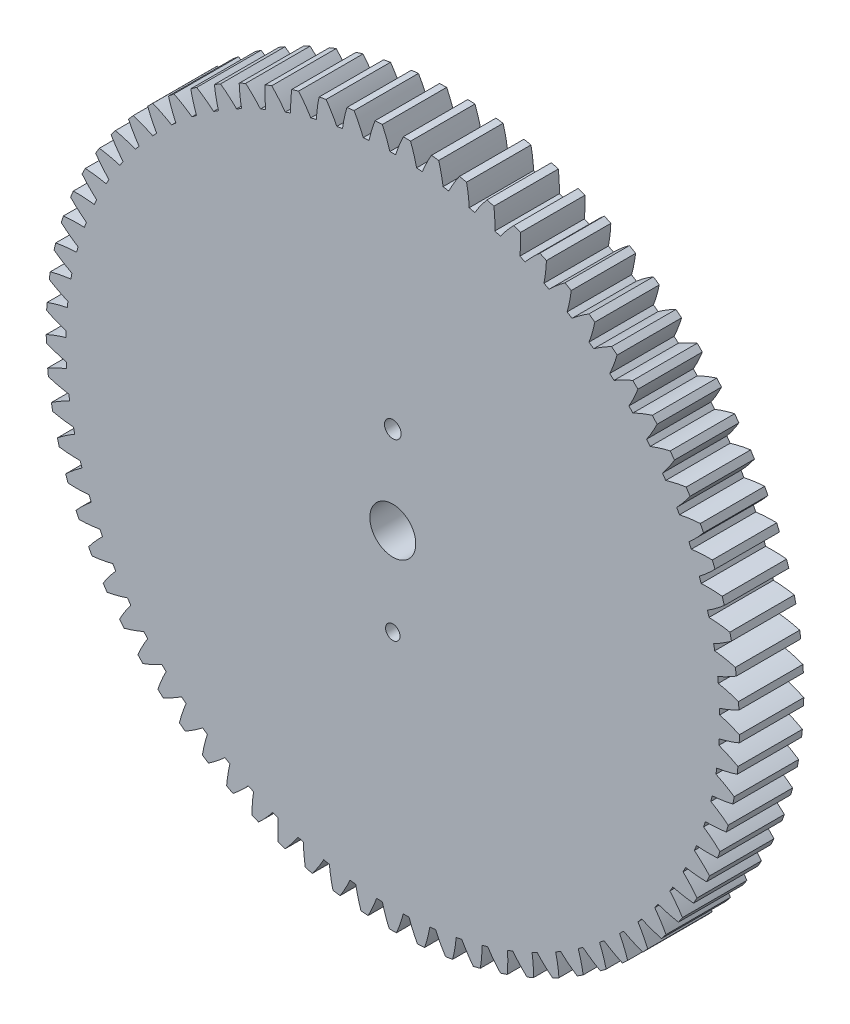
from build123d import *

# Parameters (mm, degrees)
MODEL_R             = 0.825
MODEL_R_2           = 2.625
MODEL_R_3           = 0.95
BOSS_EXTRUDE1_DEPTH = 7.364143065


with BuildPart() as part:
    # Model → Boss-Extrude1 (new body)
    with BuildSketch(Plane.XY):
        with BuildLine():
            ThreePointArc((-39.523511849, 2.834190565), (-39.550816975, 2.42353081), (-39.573855354, 2.012609605))
            ThreePointArc((-39.573855354, 2.012609605), (-38.483782884, 1.509137576), (-37.358060536, 1.091416054))
            ThreePointArc((-37.358060536, 1.091416054), (-37.366223524, 0.762374936), (-37.371488451, 0.433274691))
            ThreePointArc((-37.371488451, 0.433274691), (-38.513312242, 0.06181742), (-39.623013466, -0.396773105))
            ThreePointArc((-39.623013466, -0.396773105), (-39.616755155, -0.808292044), (-39.606222982, -1.219723785))
            ThreePointArc((-39.606222982, -1.219723785), (-38.478739993, -1.632669526), (-37.322715212, -1.957244292))
            ThreePointArc((-37.322715212, -1.957244292), (-37.304031133, -2.285855912), (-37.282453816, -2.614290244))
            ThreePointArc((-37.282453816, -2.614290244), (-38.390201066, -3.077580761), (-39.458830466, -3.625096314))
            ThreePointArc((-39.458830466, -3.625096314), (-39.419050364, -4.034735848), (-39.37501773, -4.443940114))
            ThreePointArc((-39.37501773, -4.443940114), (-38.217627437, -4.763611481), (-37.038993376, -4.9928795))
            ThreePointArc((-37.038993376, -4.9928795), (-36.993586569, -5.318874766), (-36.945310601, -5.644457508))
            ThreePointArc((-36.945310601, -5.644457508), (-38.011609436, -6.196498149), (-39.032055459, -6.829295106))
            ThreePointArc((-39.032055459, -6.829295106), (-38.959018298, -7.234329151), (-38.881778232, -7.638582755))
            ThreePointArc((-38.881778232, -7.638582755), (-37.702182875, -7.862852388), (-36.50878315, -7.995287919))
            ThreePointArc((-36.50878315, -7.995287919), (-36.43695579, -8.316497386), (-36.362302441, -8.637061839))
            ThreePointArc((-36.362302441, -8.637061839), (-37.380056817, -9.274178864), (-38.345528563, -9.988046066))
            ThreePointArc((-38.345528563, -9.988046066), (-38.239720392, -10.385779186), (-38.129786915, -10.782391887))
            ThreePointArc((-38.129786915, -10.782391887), (-36.935836507, -10.90976731), (-35.735612996, -10.944489016))
            ThreePointArc((-35.735612996, -10.944489016), (-35.637843082, -11.258775088), (-35.537309157, -11.572187948))
            ThreePointArc((-35.537309157, -11.572187948), (-36.499746087, -12.290141449), (-37.403818501, -13.080328227))
            ThreePointArc((-37.403818501, -13.080328227), (-37.265943457, -13.468113575), (-37.124048157, -13.854445981))
            ThreePointArc((-37.124048157, -13.854445981), (-35.923688241, -13.88407953), (-34.724628233, -13.820856344))
            ThreePointArc((-34.724628233, -13.820856344), (-34.601566408, -14.126127499), (-34.475820943, -14.430303056))
            ThreePointArc((-34.475820943, -14.430303056), (-35.376535569, -15.22431517), (-36.213192198, -16.085562962))
            ThreePointArc((-36.213192198, -16.085562962), (-36.044167816, -16.46081989), (-35.871254983, -16.834301023))
            ThreePointArc((-35.871254983, -16.834301023), (-34.672473757, -16.765995492), (-33.482556799, -16.605248153))
            ThreePointArc((-33.482556799, -16.605248153), (-33.335022018, -16.899472863), (-33.18490183, -17.192386878))
            ThreePointArc((-33.18490183, -17.192386878), (-34.017900043, -18.057173586), (-34.781573076, -18.983750929))
            ThreePointArc((-34.781573076, -18.983750929), (-34.582524185, -19.343982165), (-34.379744526, -19.702126568))
            ThreePointArc((-34.379744526, -19.702126568), (-33.19051968, -19.53633652), (-32.017664473, -19.279134776))
            ThreePointArc((-32.017664473, -19.279134776), (-31.846638557, -19.560355023), (-31.673142669, -19.840058201))
            ThreePointArc((-31.673142669, -19.840058201), (-32.432881005, -20.769864491), (-33.118488324, -21.755605166))
            ThreePointArc((-33.118488324, -21.755605166), (-32.890739561, -22.098413429), (-32.659442541, -22.438837712))
            ThreePointArc((-32.659442541, -22.438837712), (-31.487688171, -22.176666451), (-30.339699873, -21.824721937))
            ThreePointArc((-30.339699873, -21.824721937), (-30.146320971, -22.091066247), (-29.95060397, -22.355697211))
            ThreePointArc((-29.95060397, -22.355697211), (-30.632026495, -23.344335374), (-31.235005496, -24.38267944))
            ThreePointArc((-31.235005496, -24.38267944), (-30.980072493, -24.705783399), (-30.721797355, -25.026222094))
            ThreePointArc((-30.721797355, -25.026222094), (-29.575311292, -24.669414326), (-28.459829575, -24.225069175))
            ThreePointArc((-28.459829575, -24.225069175), (-28.245384592, -24.47476507), (-28.028748944, -24.722562744))
            ThreePointArc((-28.028748944, -24.722562744), (-28.627320902, -25.763453557), (-29.143658859, -26.847491005))
            ThreePointArc((-29.143658859, -26.847491005), (-28.863238153, -27.148740455), (-28.579703676, -27.447061096))
            ThreePointArc((-28.579703676, -27.447061096), (-27.466115596, -26.997991319), (-26.390563808, -26.464202574))
            ThreePointArc((-26.390563808, -26.464202574), (-26.156479839, -26.69558837), (-25.920367217, -26.924903701))
            ThreePointArc((-25.920367217, -26.924903701), (-26.432105212, -28.011120207), (-26.858365982, -29.133636947))
            ThreePointArc((-26.858365982, -29.133636947), (-26.554323725, -29.411027124), (-26.247416784, -29.685244435))
            ThreePointArc((-26.247416784, -29.685244435), (-25.174137433, -29.146901134), (-24.145673192, -28.527221072))
            ThreePointArc((-24.145673192, -28.527221072), (-23.893508028, -28.738756934), (-23.639489723, -28.948063866))
            ThreePointArc((-23.639489723, -28.948063866), (-24.060988223, -30.072377474), (-24.39433511, -31.225903342))
            ThreePointArc((-24.39433511, -31.225903342), (-24.068694654, -31.477588259), (-23.740457664, -31.72587737))
            ThreePointArc((-23.740457664, -31.72587737), (-22.714629538, -31.101843131), (-21.740097106, -30.400395619))
            ThreePointArc((-21.740097106, -30.400395619), (-21.471528863, -30.590673812), (-21.201295325, -30.778579443))
            ThreePointArc((-21.201295325, -30.778579443), (-21.529749327, -31.93350803), (-21.767963963, -33.110366502))
            ThreePointArc((-21.767963963, -33.110366502), (-21.422892392, -33.334671238), (-21.075509715, -33.555379825))
            ThreePointArc((-21.075509715, -33.555379825), (-20.103959532, -32.849807494), (-19.189844259, -32.07126055))
            ThreePointArc((-19.189844259, -32.07126055), (-18.906660217, -32.239014802), (-18.622009805, -32.404268651))
            ThreePointArc((-18.622009805, -32.404268651), (-18.855233502, -33.582126359), (-18.996730607, -34.774485636))
            ThreePointArc((-18.996730607, -34.774485636), (-18.634524314, -34.96991748), (-18.270307727, -35.161576764))
            ThreePointArc((-18.270307727, -35.161576764), (-17.359500991, -34.379161807), (-16.511886166, -33.528696533))
            ThreePointArc((-16.511886166, -33.528696533), (-16.215970866, -33.672810469), (-15.918797882, -33.814312797))
            ThreePointArc((-15.918797882, -33.814312797), (-16.055239208, -35.007261178), (-16.099077143, -36.207186305))
            ThreePointArc((-16.099077143, -36.207186305), (-15.722146553, -36.37244469), (-15.343519855, -36.533779211))
            ThreePointArc((-15.343519855, -36.533779211), (-14.499517836, -35.679728471), (-13.724044194, -34.763004573))
            ThreePointArc((-13.724044194, -34.763004573), (-13.417366904, -34.882519137), (-13.109648986, -34.999328271))
            ThreePointArc((-13.109648986, -34.999328271), (-13.148399947, -36.19942845), (-13.094286977, -37.398934123))
            ThreePointArc((-13.094286977, -37.398934123), (-12.705140499, -37.532919283), (-12.314623389, -37.662855385))
            ThreePointArc((-12.314623389, -37.662855385), (-11.543042782, -36.742852429), (-10.844870973, -35.765970553))
            ThreePointArc((-10.844870973, -35.765970553), (-10.529472579, -35.860090396), (-10.213257538, -35.951428991))
            ThreePointArc((-10.213257538, -35.951428991), (-10.154060253, -37.150694497), (-10.002356492, -38.341798205))
            ThreePointArc((-10.002356492, -38.341798205), (-9.603583832, -38.44361849), (-9.203775137, -38.541291471))
            ThreePointArc((-9.203775137, -38.541291471), (-8.509750682, -37.561458765), (-7.893526924, -36.530919899))
            ThreePointArc((-7.893526924, -36.530919899), (-7.571506352, -36.599018669), (-7.248898547, -36.664278881))
            ThreePointArc((-7.248898547, -36.664278881), (-7.092146963, -37.854728802), (-6.843861974, -39.029503946))
            ThreePointArc((-6.843861974, -39.029503946), (-6.438116899, -39.098481758), (-6.03167728, -39.16324162))
            ThreePointArc((-6.03167728, -39.16324162), (-5.419827596, -38.130099791), (-4.889652756, -37.052762001))
            ThreePointArc((-4.889652756, -37.052762001), (-4.563152999, -37.094386512), (-4.236299331, -37.133134045))
            ThreePointArc((-4.236299331, -37.133134045), (-3.983036606, -38.306846133), (-3.639822684, -39.457474778))
            ThreePointArc((-3.639822684, -39.457474778), (-3.229805361, -39.493151081), (-2.819439605, -39.524566858))
            ThreePointArc((-2.819439605, -39.524566858), (-2.293836451, -38.444991294), (-1.853238756, -37.328024085))
            ThreePointArc((-1.853238756, -37.328024085), (-1.524432615, -37.342897333), (-1.195508243, -37.354874328))
            ThreePointArc((-1.195508243, -37.354874328), (-0.847419797, -38.504037723), (-0.411560974, -39.622862625))
            ThreePointArc((-0.411560974, -39.622862625), (0, -39.625), (0.411560974, -39.622862625))
            ThreePointArc((0.411560974, -39.622862625), (0.847419797, -38.504037723), (1.195508243, -37.354874328))
            ThreePointArc((1.195508243, -37.354874328), (1.524432615, -37.342897333), (1.853238756, -37.328024085))
            ThreePointArc((1.853238756, -37.328024085), (2.293836451, -38.444991294), (2.819439605, -39.524566858))
            ThreePointArc((2.819439605, -39.524566858), (3.229805361, -39.493151081), (3.639822684, -39.457474778))
            ThreePointArc((3.639822684, -39.457474778), (3.983036606, -38.306846133), (4.236299331, -37.133134045))
            ThreePointArc((4.236299331, -37.133134045), (4.563152999, -37.094386512), (4.889652756, -37.052762001))
            ThreePointArc((4.889652756, -37.052762001), (5.419827596, -38.130099791), (6.03167728, -39.16324162))
            ThreePointArc((6.03167728, -39.16324162), (6.438116899, -39.098481758), (6.843861974, -39.029503946))
            ThreePointArc((6.843861974, -39.029503946), (7.092146963, -37.854728802), (7.248898547, -36.664278881))
            ThreePointArc((7.248898547, -36.664278881), (7.571506352, -36.599018669), (7.893526924, -36.530919899))
            ThreePointArc((7.893526924, -36.530919899), (8.509750682, -37.561458765), (9.203775137, -38.541291471))
            ThreePointArc((9.203775137, -38.541291471), (9.603583832, -38.44361849), (10.002356491, -38.341798205))
            ThreePointArc((10.002356491, -38.341798205), (10.154060253, -37.150694497), (10.213257538, -35.951428991))
            ThreePointArc((10.213257538, -35.951428991), (10.529472579, -35.860090396), (10.844870973, -35.765970553))
            ThreePointArc((10.844870973, -35.765970553), (11.543042782, -36.742852429), (12.314623389, -37.662855385))
            ThreePointArc((12.314623389, -37.662855385), (12.705140499, -37.532919283), (13.094286977, -37.398934123))
            ThreePointArc((13.094286977, -37.398934123), (13.148399947, -36.19942845), (13.109648986, -34.999328272))
            ThreePointArc((13.109648986, -34.999328272), (13.417366904, -34.882519137), (13.724044194, -34.763004573))
            ThreePointArc((13.724044194, -34.763004573), (14.499517836, -35.679728471), (15.343519855, -36.533779211))
            ThreePointArc((15.343519855, -36.533779211), (15.722146553, -36.372444691), (16.099077143, -36.207186305))
            ThreePointArc((16.099077143, -36.207186305), (16.055239208, -35.007261178), (15.918797882, -33.814312798))
            ThreePointArc((15.918797882, -33.814312798), (16.215970866, -33.672810469), (16.511886166, -33.528696534))
            ThreePointArc((16.511886166, -33.528696534), (17.359500991, -34.379161808), (18.270307727, -35.161576764))
            ThreePointArc((18.270307727, -35.161576764), (18.634524315, -34.96991748), (18.996730607, -34.774485636))
            ThreePointArc((18.996730607, -34.774485636), (18.855233502, -33.58212636), (18.622009805, -32.404268651))
            ThreePointArc((18.622009805, -32.404268651), (18.906660217, -32.239014803), (19.18984426, -32.07126055))
            ThreePointArc((19.18984426, -32.07126055), (20.103959532, -32.849807494), (21.075509716, -33.555379825))
            ThreePointArc((21.075509716, -33.555379825), (21.422892392, -33.334671238), (21.767963963, -33.110366502))
            ThreePointArc((21.767963963, -33.110366502), (21.529749328, -31.933508031), (21.201295325, -30.778579443))
            ThreePointArc((21.201295325, -30.778579443), (21.471528863, -30.590673812), (21.740097106, -30.40039562))
            ThreePointArc((21.740097106, -30.40039562), (22.714629538, -31.101843132), (23.740457664, -31.72587737))
            ThreePointArc((23.740457664, -31.72587737), (24.068694654, -31.477588259), (24.39433511, -31.225903342))
            ThreePointArc((24.39433511, -31.225903342), (24.060988224, -30.072377474), (23.639489723, -28.948063867))
            ThreePointArc((23.639489723, -28.948063867), (23.893508028, -28.738756934), (24.145673193, -28.527221072))
            ThreePointArc((24.145673193, -28.527221072), (25.174137433, -29.146901135), (26.247416784, -29.685244435))
            ThreePointArc((26.247416784, -29.685244435), (26.554323725, -29.411027124), (26.858365982, -29.133636947))
            ThreePointArc((26.858365982, -29.133636947), (26.432105213, -28.011120208), (25.920367217, -26.924903701))
            ThreePointArc((25.920367217, -26.924903701), (26.156479839, -26.69558837), (26.390563808, -26.464202574))
            ThreePointArc((26.390563808, -26.464202574), (27.466115597, -26.99799132), (28.579703676, -27.447061096))
            ThreePointArc((28.579703676, -27.447061096), (28.863238153, -27.148740456), (29.14365886, -26.847491005))
            ThreePointArc((29.14365886, -26.847491005), (28.627320903, -25.763453557), (28.028748944, -24.722562744))
            ThreePointArc((28.028748944, -24.722562744), (28.245384592, -24.47476507), (28.459829575, -24.225069175))
            ThreePointArc((28.459829575, -24.225069175), (29.575311292, -24.669414327), (30.721797355, -25.026222094))
            ThreePointArc((30.721797355, -25.026222094), (30.980072493, -24.705783399), (31.235005496, -24.38267944))
            ThreePointArc((31.235005496, -24.38267944), (30.632026495, -23.344335374), (29.950603971, -22.355697211))
            ThreePointArc((29.950603971, -22.355697211), (30.146320971, -22.091066247), (30.339699873, -21.824721937))
            ThreePointArc((30.339699873, -21.824721937), (31.487688171, -22.176666451), (32.659442541, -22.438837712))
            ThreePointArc((32.659442541, -22.438837712), (32.890739562, -22.098413429), (33.118488324, -21.755605166))
            ThreePointArc((33.118488324, -21.755605166), (32.432881005, -20.769864491), (31.673142669, -19.840058201))
            ThreePointArc((31.673142669, -19.840058201), (31.846638557, -19.560355023), (32.017664473, -19.279134776))
            ThreePointArc((32.017664473, -19.279134776), (33.19051968, -19.53633652), (34.379744526, -19.702126568))
            ThreePointArc((34.379744526, -19.702126568), (34.582524185, -19.343982165), (34.781573076, -18.983750929))
            ThreePointArc((34.781573076, -18.983750929), (34.017900043, -18.057173586), (33.18490183, -17.192386878))
            ThreePointArc((33.18490183, -17.192386878), (33.335022018, -16.899472863), (33.482556799, -16.605248153))
            ThreePointArc((33.482556799, -16.605248153), (34.672473757, -16.765995492), (35.871254983, -16.834301023))
            ThreePointArc((35.871254983, -16.834301023), (36.044167816, -16.46081989), (36.213192198, -16.085562962))
            ThreePointArc((36.213192198, -16.085562962), (35.376535569, -15.22431517), (34.475820943, -14.430303056))
            ThreePointArc((34.475820943, -14.430303056), (34.601566408, -14.126127499), (34.724628233, -13.820856344))
            ThreePointArc((34.724628233, -13.820856344), (35.923688241, -13.88407953), (37.124048157, -13.854445981))
            ThreePointArc((37.124048157, -13.854445981), (37.265943457, -13.468113575), (37.403818501, -13.080328227))
            ThreePointArc((37.403818501, -13.080328227), (36.499746087, -12.290141449), (35.537309157, -11.572187948))
            ThreePointArc((35.537309157, -11.572187948), (35.637843082, -11.258775088), (35.735612996, -10.944489016))
            ThreePointArc((35.735612996, -10.944489016), (36.935836507, -10.90976731), (38.129786915, -10.782391887))
            ThreePointArc((38.129786915, -10.782391887), (38.239720392, -10.385779186), (38.345528563, -9.988046066))
            ThreePointArc((38.345528563, -9.988046066), (37.380056817, -9.274178864), (36.362302441, -8.637061839))
            ThreePointArc((36.362302441, -8.637061839), (36.43695579, -8.316497386), (36.50878315, -7.995287919))
            ThreePointArc((36.50878315, -7.995287919), (37.702182875, -7.862852388), (38.881778232, -7.638582755))
            ThreePointArc((38.881778232, -7.638582755), (38.959018298, -7.234329151), (39.032055459, -6.829295106))
            ThreePointArc((39.032055459, -6.829295106), (38.011609436, -6.196498149), (36.945310601, -5.644457508))
            ThreePointArc((36.945310601, -5.644457508), (36.993586569, -5.318874766), (37.038993376, -4.9928795))
            ThreePointArc((37.038993376, -4.9928795), (38.217627437, -4.763611481), (39.37501773, -4.443940114))
            ThreePointArc((39.37501773, -4.443940114), (39.419050364, -4.034735848), (39.458830466, -3.625096314))
            ThreePointArc((39.458830466, -3.625096314), (38.390201066, -3.077580761), (37.282453816, -2.614290244))
            ThreePointArc((37.282453816, -2.614290244), (37.304031133, -2.285855912), (37.322715212, -1.957244292))
            ThreePointArc((37.322715212, -1.957244292), (38.478739993, -1.632669526), (39.606222982, -1.219723785))
            ThreePointArc((39.606222982, -1.219723785), (39.616755154, -0.808292044), (39.623013466, -0.396773105))
            ThreePointArc((39.623013466, -0.396773105), (38.513312242, 0.06181742), (37.371488451, 0.433274691))
            ThreePointArc((37.371488451, 0.433274691), (37.366223524, 0.762374936), (37.358060536, 1.091416054))
            ThreePointArc((37.358060536, 1.091416054), (38.483782884, 1.509137576), (39.573855354, 2.012609605))
            ThreePointArc((39.573855354, 2.012609605), (39.550816975, 2.42353081), (39.523511848, 2.834190565))
            ThreePointArc((39.523511848, 2.834190565), (38.380123679, 3.200804215), (37.211821996, 3.477956254))
            ThreePointArc((37.211821996, 3.477956254), (37.179749863, 3.805532305), (37.144794131, 4.132813206))
            ThreePointArc((37.144794131, 4.132813206), (38.232722548, 4.640901616), (39.278130248, 5.231549409))
            ThreePointArc((39.278130248, 5.231549409), (39.221674635, 5.639225467), (39.160987781, 6.046293163))
            ThreePointArc((39.160987781, 6.046293163), (37.991521725, 6.318490187), (36.804517006, 6.499492592))
            ThreePointArc((36.804517006, 6.499492592), (36.745851101, 6.823364484), (36.684335249, 7.146707168))
            ThreePointArc((36.684335249, 7.146707168), (37.727229752, 7.741781222), (38.721015666, 8.415674116))
            ThreePointArc((38.721015666, 8.415674116), (38.63151852, 8.817392008), (38.537853801, 9.218158679))
            ThreePointArc((38.537853801, 9.218158679), (37.350092463, 9.394127649), (36.152284027, 9.477775879))
            ThreePointArc((36.152284027, 9.477775879), (36.067414762, 9.795788298), (35.979748169, 10.113040973))
            ThreePointArc((35.979748169, 10.113040973), (36.970668467, 10.791140551), (37.906219112, 11.543793899))
            ThreePointArc((37.906219112, 11.543793899), (37.784276024, 11.93688026), (37.658256762, 12.328678869))
            ThreePointArc((37.658256762, 12.328678869), (36.460104497, 12.407248741), (35.259463563, 12.392986131))
            ThreePointArc((35.259463563, 12.392986131), (35.148955729, 12.703022757), (35.035721801, 13.012074159))
            ThreePointArc((35.035721801, 13.012074159), (35.968073482, 13.76868662), (36.839162925, 14.595091639))
            ThreePointArc((36.839162925, 14.595091639), (36.685585405, 14.976930544), (36.528050237, 15.357153735))
            ThreePointArc((36.528050237, 15.357153735), (35.327480552, 15.33780164), (34.131997186, 15.225723105))
            ThreePointArc((34.131997186, 15.225723105), (33.996586194, 15.525720696), (33.858538484, 15.824514138))
            ThreePointArc((33.858538484, 15.824514138), (34.726116903, 16.654604351), (35.526948187, 17.549261453))
            ThreePointArc((35.526948187, 17.549261453), (35.342758267, 17.917311826), (35.154755565, 18.283429277))
            ThreePointArc((35.154755565, 18.283429277), (33.959758051, 18.166283999), (32.777388, 17.957135404))
            ThreePointArc((32.777388, 17.957135404), (32.617974988, 18.245097525), (32.456032181, 18.531644586))
            ThreePointArc((32.456032181, 18.531644586), (33.253063745, 19.429688438), (33.97830747, 20.386643826))
            ThreePointArc((33.97830747, 20.386643826), (33.764730904, 20.738456354), (33.547511795, 21.088031614))
            ThreePointArc((33.547511795, 21.088031614), (32.366038964, 20.873872736), (31.204650704, 20.56904593))
            ThreePointArc((31.204650704, 20.56904593), (31.022296539, 20.84305624), (30.837536338, 21.115449998))
            ThreePointArc((30.837536338, 21.115449998), (31.558716935, 22.075471154), (32.203546722, 23.088356448))
            ThreePointArc((32.203546722, 23.088356448), (31.962004829, 23.421589876), (31.717014869, 23.75229658))
            ThreePointArc((31.717014869, 23.75229658), (30.556929228, 23.442549294), (29.424251606, 23.044072849))
            ThreePointArc((29.424251606, 23.044072849), (29.220169826, 23.302307855), (29.013821779, 23.558735573))
            ThreePointArc((29.013821779, 23.558735573), (29.65435207, 24.574345252), (30.214476685, 25.636419868))
            ThreePointArc((30.214476685, 25.636419868), (29.946576884, 25.948856583), (29.675446441, 26.258493931))
            ThreePointArc((29.675446441, 26.258493931), (28.54446817, 25.855219554), (27.448038968, 25.365745264))
            ThreePointArc((27.448038968, 25.365745264), (27.223587703, 25.606486455), (26.997025022, 25.84524165))
            ThreePointArc((26.997025022, 25.84524165), (27.552642385, 26.909681137), (28.02433429, 28.013877143))
            ThreePointArc((28.02433429, 28.013877143), (27.731859411, 28.303437929), (27.436392814, 28.589945337))
            ThreePointArc((27.436392814, 28.589945337), (26.342048385, 28.095827593), (25.289164159, 27.518612831))
            ThreePointArc((25.289164159, 27.518612831), (25.045837095, 27.740258113), (24.800567519, 27.959751908))
            ThreePointArc((24.800567519, 27.959751908), (25.26757441, 29.065937533), (25.647694574, 30.204906688))
            ThreePointArc((25.647694574, 30.204906688), (25.332590989, 30.469664567), (25.014754519, 30.731135373))
            ThreePointArc((25.014754519, 30.731135373), (23.964326614, 30.149462536), (22.961994136, 29.488348569))
            ThreePointArc((22.961994136, 29.488348569), (22.701410574, 29.68942293), (22.43906633, 29.88819463))
            ThreePointArc((22.43906633, 29.88819463), (22.814354897, 31.028764911), (23.100373683, 32.194927562))
            ThreePointArc((23.100373683, 32.194927562), (22.764738353, 32.433120613), (22.42664716, 32.667814774))
            ThreePointArc((22.42664716, 32.667814774), (21.427126203, 32.002457779), (20.48201583, 31.261844212))
            ThreePointArc((20.48201583, 31.261844212), (20.205909912, 31.441009536), (19.928236857, 31.617736348))
            ThreePointArc((19.928236857, 31.617736348), (20.209309616, 32.785100978), (20.399323615, 33.970696505))
            ThreePointArc((20.399323615, 33.970696505), (20.04539014, 34.180739593), (19.689294165, 34.387095258))
            ThreePointArc((19.689294165, 34.387095258), (18.747331803, 33.642481946), (17.865733087, 32.82729744))
            ThreePointArc((17.865733087, 32.82729744), (17.575942252, 32.983361411), (17.284788256, 33.136867247))
            ThreePointArc((17.284788256, 33.136867247), (17.469774713, 34.323257607), (17.562519415, 35.520396067))
            ThreePointArc((17.562519415, 35.520396067), (17.192643162, 35.700891391), (16.820912165, 35.877535296))
            ThreePointArc((16.820912165, 35.877535296), (15.942777003, 35.058620947), (15.130556839, 34.17429042))
            ThreePointArc((15.130556839, 34.17429042), (14.829009596, 34.306214457), (14.52631224, 34.435477762))
            ThreePointArc((14.52631224, 34.435477762), (14.613981343, 35.632998619), (14.608839546, 36.833713255))
            ThreePointArc((14.608839546, 36.833713255), (14.225481981, 36.983459646), (13.84058977, 37.129216256))
            ThreePointArc((13.84058977, 37.129216256), (13.032125652, 36.241450609), (12.294689232, 35.293859136))
            ThreePointArc((12.294689232, 35.293859136), (11.983392329, 35.400765307), (11.671166014, 35.504925854))
            ThreePointArc((11.671166014, 35.504925854), (11.660934337, 36.705607905), (11.55794026, 37.901908157))
            ThreePointArc((11.55794026, 37.901908157), (11.163652565, 38.019909079), (10.768160533, 38.133808408))
            ThreePointArc((10.768160533, 38.133808408), (10.034747655, 37.183099397), (9.377002496, 36.178553042))
            ThreePointArc((9.377002496, 36.178553042), (9.058027562, 36.259729904), (8.738350103, 36.338094522))
            ThreePointArc((8.738350103, 36.338094522), (8.630285738, 37.533947426), (8.430124788, 38.717872114))
            ThreePointArc((8.430124788, 38.717872114), (8.027530882, 38.803342291), (7.624070965, 38.884626357))
            ThreePointArc((7.624070965, 38.884626357), (6.970590069, 37.877300793), (6.396913355, 36.822484646))
            ThreePointArc((6.396913355, 36.822484646), (6.072383117, 36.877391981), (5.747381914, 36.929439166))
            ThreePointArc((5.747381914, 36.929439166), (5.54220401, 38.112504719), (5.246208227, 39.276175021))
            ThreePointArc((5.246208227, 39.276175021), (4.837987306, 39.328545661), (4.429244463, 39.376673533))
            ThreePointArc((4.429244463, 39.376673533), (3.860044355, 38.319435002), (3.374253812, 37.221368691))
            ThreePointArc((3.374253812, 37.221368691), (3.046327963, 37.249641098), (2.718165847, 37.275024486))
            ThreePointArc((2.718165847, 37.275024486), (2.41723983, 38.437429582), (2.027379015, 39.573101462))
            ThreePointArc((2.027379015, 39.573101462), (1.616247723, 39.592024049), (1.204942069, 39.606675443))
            ThreePointArc((1.204942069, 39.606675443), (0.723810683, 38.506559692), (0.329139166, 37.372550668))
            ThreePointArc((0.329139166, 37.372550668), (0, 37.374), (-0.329139166, 37.372550668))
            ThreePointArc((-0.329139166, 37.372550668), (-0.723810683, 38.506559693), (-1.204942069, 39.606675443))
            ThreePointArc((-1.204942069, 39.606675443), (-1.616247723, 39.592024049), (-2.027379015, 39.573101462))
            ThreePointArc((-2.027379015, 39.573101462), (-2.41723983, 38.437429582), (-2.718165847, 37.275024486))
            ThreePointArc((-2.718165847, 37.275024486), (-3.046327963, 37.249641098), (-3.374253812, 37.221368691))
            ThreePointArc((-3.374253812, 37.221368691), (-3.860044355, 38.319435002), (-4.429244463, 39.376673533))
            ThreePointArc((-4.429244463, 39.376673533), (-4.837987306, 39.328545661), (-5.246208227, 39.276175021))
            ThreePointArc((-5.246208227, 39.276175021), (-5.54220401, 38.112504719), (-5.747381914, 36.929439166))
            ThreePointArc((-5.747381914, 36.929439166), (-6.072383117, 36.877391981), (-6.396913355, 36.822484646))
            ThreePointArc((-6.396913355, 36.822484646), (-6.970590069, 37.877300793), (-7.624070965, 38.884626357))
            ThreePointArc((-7.624070965, 38.884626357), (-8.027530882, 38.803342291), (-8.430124788, 38.717872114))
            ThreePointArc((-8.430124788, 38.717872114), (-8.630285738, 37.533947426), (-8.738350103, 36.338094522))
            ThreePointArc((-8.738350103, 36.338094522), (-9.058027562, 36.259729904), (-9.377002496, 36.178553042))
            ThreePointArc((-9.377002496, 36.178553042), (-10.034747655, 37.183099397), (-10.768160533, 38.133808408))
            ThreePointArc((-10.768160533, 38.133808408), (-11.163652565, 38.019909079), (-11.55794026, 37.901908157))
            ThreePointArc((-11.55794026, 37.901908157), (-11.660934337, 36.705607905), (-11.671166014, 35.504925854))
            ThreePointArc((-11.671166014, 35.504925854), (-11.983392329, 35.400765307), (-12.294689232, 35.293859136))
            ThreePointArc((-12.294689232, 35.293859136), (-13.032125652, 36.241450609), (-13.84058977, 37.129216256))
            ThreePointArc((-13.84058977, 37.129216256), (-14.225481981, 36.983459646), (-14.608839546, 36.833713255))
            ThreePointArc((-14.608839546, 36.833713255), (-14.613981343, 35.632998619), (-14.526312241, 34.435477762))
            ThreePointArc((-14.526312241, 34.435477762), (-14.829009596, 34.306214457), (-15.130556839, 34.17429042))
            ThreePointArc((-15.130556839, 34.17429042), (-15.942777003, 35.058620947), (-16.820912165, 35.877535296))
            ThreePointArc((-16.820912165, 35.877535296), (-17.192643163, 35.700891391), (-17.562519415, 35.520396068))
            ThreePointArc((-17.562519415, 35.520396068), (-17.469774713, 34.323257607), (-17.284788256, 33.136867247))
            ThreePointArc((-17.284788256, 33.136867247), (-17.575942252, 32.983361411), (-17.865733088, 32.82729744))
            ThreePointArc((-17.865733088, 32.82729744), (-18.747331803, 33.642481946), (-19.689294165, 34.387095258))
            ThreePointArc((-19.689294165, 34.387095258), (-20.04539014, 34.180739593), (-20.399323615, 33.970696505))
            ThreePointArc((-20.399323615, 33.970696505), (-20.209309616, 32.785100978), (-19.928236857, 31.617736348))
            ThreePointArc((-19.928236857, 31.617736348), (-20.205909912, 31.441009536), (-20.48201583, 31.261844212))
            ThreePointArc((-20.48201583, 31.261844212), (-21.427126204, 32.002457779), (-22.42664716, 32.667814775))
            ThreePointArc((-22.42664716, 32.667814775), (-22.764738353, 32.433120613), (-23.100373683, 32.194927562))
            ThreePointArc((-23.100373683, 32.194927562), (-22.814354897, 31.028764911), (-22.43906633, 29.88819463))
            ThreePointArc((-22.43906633, 29.88819463), (-22.701410575, 29.68942293), (-22.961994136, 29.488348569))
            ThreePointArc((-22.961994136, 29.488348569), (-23.964326614, 30.149462536), (-25.014754519, 30.731135373))
            ThreePointArc((-25.014754519, 30.731135373), (-25.332590989, 30.469664567), (-25.647694574, 30.204906688))
            ThreePointArc((-25.647694574, 30.204906688), (-25.26757441, 29.065937533), (-24.800567519, 27.959751908))
            ThreePointArc((-24.800567519, 27.959751908), (-25.045837096, 27.740258113), (-25.289164159, 27.518612831))
            ThreePointArc((-25.289164159, 27.518612831), (-26.342048385, 28.095827593), (-27.436392814, 28.589945337))
            ThreePointArc((-27.436392814, 28.589945337), (-27.731859411, 28.303437929), (-28.02433429, 28.013877143))
            ThreePointArc((-28.02433429, 28.013877143), (-27.552642385, 26.909681137), (-26.997025022, 25.84524165))
            ThreePointArc((-26.997025022, 25.84524165), (-27.223587703, 25.606486455), (-27.448038968, 25.365745264))
            ThreePointArc((-27.448038968, 25.365745264), (-28.54446817, 25.855219554), (-29.675446442, 26.258493931))
            ThreePointArc((-29.675446442, 26.258493931), (-29.946576884, 25.948856583), (-30.214476685, 25.636419868))
            ThreePointArc((-30.214476685, 25.636419868), (-29.65435207, 24.574345252), (-29.013821779, 23.558735573))
            ThreePointArc((-29.013821779, 23.558735573), (-29.220169826, 23.302307855), (-29.424251606, 23.044072849))
            ThreePointArc((-29.424251606, 23.044072849), (-30.556929228, 23.442549294), (-31.717014869, 23.75229658))
            ThreePointArc((-31.717014869, 23.75229658), (-31.962004829, 23.421589876), (-32.203546723, 23.088356449))
            ThreePointArc((-32.203546723, 23.088356449), (-31.558716935, 22.075471154), (-30.837536338, 21.115449998))
            ThreePointArc((-30.837536338, 21.115449998), (-31.022296539, 20.84305624), (-31.204650704, 20.56904593))
            ThreePointArc((-31.204650704, 20.56904593), (-32.366038965, 20.873872736), (-33.547511795, 21.088031614))
            ThreePointArc((-33.547511795, 21.088031614), (-33.764730905, 20.738456354), (-33.97830747, 20.386643826))
            ThreePointArc((-33.97830747, 20.386643826), (-33.253063745, 19.429688438), (-32.456032181, 18.531644586))
            ThreePointArc((-32.456032181, 18.531644586), (-32.617974988, 18.245097525), (-32.777388, 17.957135404))
            ThreePointArc((-32.777388, 17.957135404), (-33.959758051, 18.166283999), (-35.154755565, 18.283429277))
            ThreePointArc((-35.154755565, 18.283429277), (-35.342758267, 17.917311826), (-35.526948187, 17.549261453))
            ThreePointArc((-35.526948187, 17.549261453), (-34.726116903, 16.654604351), (-33.858538484, 15.824514138))
            ThreePointArc((-33.858538484, 15.824514138), (-33.996586194, 15.525720696), (-34.131997186, 15.225723105))
            ThreePointArc((-34.131997186, 15.225723105), (-35.327480552, 15.33780164), (-36.528050237, 15.357153735))
            ThreePointArc((-36.528050237, 15.357153735), (-36.685585405, 14.976930544), (-36.839162925, 14.595091639))
            ThreePointArc((-36.839162925, 14.595091639), (-35.968073482, 13.76868662), (-35.035721801, 13.012074159))
            ThreePointArc((-35.035721801, 13.012074159), (-35.148955729, 12.703022757), (-35.259463563, 12.392986131))
            ThreePointArc((-35.259463563, 12.392986131), (-36.460104497, 12.407248741), (-37.658256762, 12.328678869))
            ThreePointArc((-37.658256762, 12.328678869), (-37.784276024, 11.93688026), (-37.906219113, 11.543793899))
            ThreePointArc((-37.906219113, 11.543793899), (-36.970668467, 10.791140551), (-35.979748169, 10.113040973))
            ThreePointArc((-35.979748169, 10.113040973), (-36.067414762, 9.795788298), (-36.152284027, 9.477775879))
            ThreePointArc((-36.152284027, 9.477775879), (-37.350092463, 9.394127648), (-38.537853801, 9.218158679))
            ThreePointArc((-38.537853801, 9.218158679), (-38.63151852, 8.817392008), (-38.721015666, 8.415674116))
            ThreePointArc((-38.721015666, 8.415674116), (-37.727229752, 7.741781222), (-36.684335249, 7.146707168))
            ThreePointArc((-36.684335249, 7.146707168), (-36.745851101, 6.823364484), (-36.804517006, 6.499492592))
            ThreePointArc((-36.804517006, 6.499492592), (-37.991521725, 6.318490187), (-39.160987781, 6.046293163))
            ThreePointArc((-39.160987781, 6.046293163), (-39.221674635, 5.639225467), (-39.278130248, 5.231549409))
            ThreePointArc((-39.278130248, 5.231549409), (-38.232722548, 4.640901616), (-37.144794131, 4.132813206))
            ThreePointArc((-37.144794131, 4.132813206), (-37.179749863, 3.805532305), (-37.211821996, 3.477956254))
            ThreePointArc((-37.211821996, 3.477956254), (-38.380123679, 3.200804215), (-39.523511849, 2.834190565))
        make_face()
        with Locations((0, -10.05)):
            Circle(MODEL_R, mode=Mode.SUBTRACT)
        Circle(MODEL_R_2, mode=Mode.SUBTRACT)
        with Locations((0, 10.05)):
            Circle(MODEL_R_3, mode=Mode.SUBTRACT)
    extrude(amount=BOSS_EXTRUDE1_DEPTH)


solid = part.part
